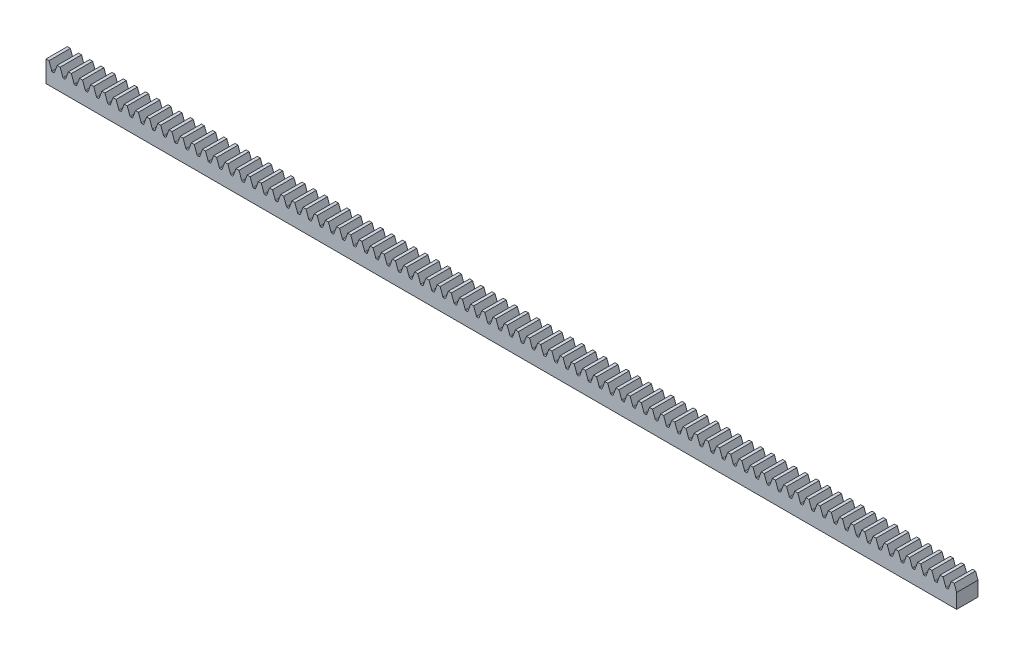
from build123d import *

# Parameters (mm, degrees)
SKETCH1_W           = 203.2
SKETCH1_H           = 4.7752
BOSS_EXTRUDE1_DEPTH = 2.38125
CUT_EXTRUDE1_DEPTH  = 4.7625
FILLET3_R           = 0.154943948
LPATTERN4_START     = -2.38125
LPATTERN4_DEPTH     = 4.7625


# Read off the part's stored shape, not the designer's step: LPattern4
with BuildPart() as part:
    # Sketch1 → Boss-Extrude1 (new, symmetric)
    with BuildSketch(Plane.XY):
        Rectangle(SKETCH1_W, SKETCH1_H)
    extrude(amount=BOSS_EXTRUDE1_DEPTH, both=True)

    # Sketch2 → Cut-Extrude1 (cut)
    with BuildSketch(Plane.XY.offset(2.38125)):
        Polygon((-100.930980247, 2.3876), (-100.276907537, 0.59055), (-99.760427709, 0.59055), (-99.106355, 2.3876), align=None)
    extrude(amount=-CUT_EXTRUDE1_DEPTH, mode=Mode.SUBTRACT)

    # Fillet3
    fillet3_edges = [part.edges().sort_by_distance(p)[0] for p in [
        (-99.760427709, 0.59055, 0),
        (-100.276907537, 0.59055, 0),
    ]]
    fillet(fillet3_edges, radius=FILLET3_R)

    # LPattern4 outline → LPattern4 (cut)
    with BuildSketch(Plane.XY.offset(LPATTERN4_START)):
        with BuildLine():
            ThreePointArc((-97.820369302, 0.692499997), (-97.763641815, 0.618571296), (-97.674769617, 0.59055))
            Line((-97.674769617, 0.59055), (-97.37527563, 0.59055))
            ThreePointArc((-97.37527563, 0.59055), (-97.286403432, 0.618571296), (-97.229675945, 0.692499997))
            Line((-97.229675945, 0.692499997), (-96.61271, 2.3876))
            Line((-96.61271, 2.3876), (-98.437335247, 2.3876))
            Line((-98.437335247, 2.3876), (-97.820369302, 0.692499997))
        make_face()
        Polygon((101.6, 2.3876), (101.054264753, 2.3876), (101.6, 0.888204732), align=None)
        with BuildLine():
            Line((100.385245, 2.3876), (98.560619753, 2.3876))
            Line((98.560619753, 2.3876), (99.177585698, 0.692499997))
            ThreePointArc((99.177585698, 0.692499997), (99.234313185, 0.618571296), (99.323185383, 0.59055))
            Line((99.323185383, 0.59055), (99.62267937, 0.59055))
            ThreePointArc((99.62267937, 0.59055), (99.711551568, 0.618571296), (99.768279055, 0.692499997))
            Line((99.768279055, 0.692499997), (100.385245, 2.3876))
        make_face()
        with BuildLine():
            Line((97.8916, 2.3876), (96.066974753, 2.3876))
            Line((96.066974753, 2.3876), (96.683940698, 0.692499997))
            ThreePointArc((96.683940698, 0.692499997), (96.740668185, 0.618571296), (96.829540383, 0.59055))
            Line((96.829540383, 0.59055), (97.12903437, 0.59055))
            ThreePointArc((97.12903437, 0.59055), (97.217906568, 0.618571296), (97.274634055, 0.692499997))
            Line((97.274634055, 0.692499997), (97.8916, 2.3876))
        make_face()
        with BuildLine():
            Line((95.397955, 2.3876), (93.573329753, 2.3876))
            Line((93.573329753, 2.3876), (94.190295698, 0.692499997))
            ThreePointArc((94.190295698, 0.692499997), (94.247023185, 0.618571296), (94.335895383, 0.59055))
            Line((94.335895383, 0.59055), (94.63538937, 0.59055))
            ThreePointArc((94.63538937, 0.59055), (94.724261568, 0.618571296), (94.780989055, 0.692499997))
            Line((94.780989055, 0.692499997), (95.397955, 2.3876))
        make_face()
        with BuildLine():
            Line((92.90431, 2.3876), (91.079684753, 2.3876))
            Line((91.079684753, 2.3876), (91.696650698, 0.692499997))
            ThreePointArc((91.696650698, 0.692499997), (91.753378185, 0.618571296), (91.842250383, 0.59055))
            Line((91.842250383, 0.59055), (92.14174437, 0.59055))
            ThreePointArc((92.14174437, 0.59055), (92.230616568, 0.618571296), (92.287344055, 0.692499997))
            Line((92.287344055, 0.692499997), (92.90431, 2.3876))
        make_face()
        with BuildLine():
            Line((90.410665, 2.3876), (88.586039753, 2.3876))
            Line((88.586039753, 2.3876), (89.203005698, 0.692499997))
            ThreePointArc((89.203005698, 0.692499997), (89.259733185, 0.618571296), (89.348605383, 0.59055))
            Line((89.348605383, 0.59055), (89.64809937, 0.59055))
            ThreePointArc((89.64809937, 0.59055), (89.736971568, 0.618571296), (89.793699055, 0.692499997))
            Line((89.793699055, 0.692499997), (90.410665, 2.3876))
        make_face()
        with BuildLine():
            Line((87.91702, 2.3876), (86.092394753, 2.3876))
            Line((86.092394753, 2.3876), (86.709360698, 0.692499997))
            ThreePointArc((86.709360698, 0.692499997), (86.766088185, 0.618571296), (86.854960383, 0.59055))
            Line((86.854960383, 0.59055), (87.15445437, 0.59055))
            ThreePointArc((87.15445437, 0.59055), (87.243326568, 0.618571296), (87.300054055, 0.692499997))
            Line((87.300054055, 0.692499997), (87.91702, 2.3876))
        make_face()
        with BuildLine():
            Line((85.423375, 2.3876), (83.598749753, 2.3876))
            Line((83.598749753, 2.3876), (84.215715698, 0.692499997))
            ThreePointArc((84.215715698, 0.692499997), (84.272443185, 0.618571296), (84.361315383, 0.59055))
            Line((84.361315383, 0.59055), (84.66080937, 0.59055))
            ThreePointArc((84.66080937, 0.59055), (84.749681568, 0.618571296), (84.806409055, 0.692499997))
            Line((84.806409055, 0.692499997), (85.423375, 2.3876))
        make_face()
        with BuildLine():
            Line((82.92973, 2.3876), (81.105104753, 2.3876))
            Line((81.105104753, 2.3876), (81.722070698, 0.692499997))
            ThreePointArc((81.722070698, 0.692499997), (81.778798185, 0.618571296), (81.867670383, 0.59055))
            Line((81.867670383, 0.59055), (82.16716437, 0.59055))
            ThreePointArc((82.16716437, 0.59055), (82.256036568, 0.618571296), (82.312764055, 0.692499997))
            Line((82.312764055, 0.692499997), (82.92973, 2.3876))
        make_face()
        with BuildLine():
            Line((80.436085, 2.3876), (78.611459753, 2.3876))
            Line((78.611459753, 2.3876), (79.228425698, 0.692499997))
            ThreePointArc((79.228425698, 0.692499997), (79.285153185, 0.618571296), (79.374025383, 0.59055))
            Line((79.374025383, 0.59055), (79.67351937, 0.59055))
            ThreePointArc((79.67351937, 0.59055), (79.762391568, 0.618571296), (79.819119055, 0.692499997))
            Line((79.819119055, 0.692499997), (80.436085, 2.3876))
        make_face()
        with BuildLine():
            Line((77.94244, 2.3876), (76.117814753, 2.3876))
            Line((76.117814753, 2.3876), (76.734780698, 0.692499997))
            ThreePointArc((76.734780698, 0.692499997), (76.791508185, 0.618571296), (76.880380383, 0.59055))
            Line((76.880380383, 0.59055), (77.17987437, 0.59055))
            ThreePointArc((77.17987437, 0.59055), (77.268746568, 0.618571296), (77.325474055, 0.692499997))
            Line((77.325474055, 0.692499997), (77.94244, 2.3876))
        make_face()
        with BuildLine():
            Line((75.448795, 2.3876), (73.624169753, 2.3876))
            Line((73.624169753, 2.3876), (74.241135698, 0.692499997))
            ThreePointArc((74.241135698, 0.692499997), (74.297863185, 0.618571296), (74.386735383, 0.59055))
            Line((74.386735383, 0.59055), (74.68622937, 0.59055))
            ThreePointArc((74.68622937, 0.59055), (74.775101568, 0.618571296), (74.831829055, 0.692499997))
            Line((74.831829055, 0.692499997), (75.448795, 2.3876))
        make_face()
        with BuildLine():
            Line((72.95515, 2.3876), (71.130524753, 2.3876))
            Line((71.130524753, 2.3876), (71.747490698, 0.692499997))
            ThreePointArc((71.747490698, 0.692499997), (71.804218185, 0.618571296), (71.893090383, 0.59055))
            Line((71.893090383, 0.59055), (72.19258437, 0.59055))
            ThreePointArc((72.19258437, 0.59055), (72.281456568, 0.618571296), (72.338184055, 0.692499997))
            Line((72.338184055, 0.692499997), (72.95515, 2.3876))
        make_face()
        with BuildLine():
            Line((70.461505, 2.3876), (68.636879753, 2.3876))
            Line((68.636879753, 2.3876), (69.253845698, 0.692499997))
            ThreePointArc((69.253845698, 0.692499997), (69.310573185, 0.618571296), (69.399445383, 0.59055))
            Line((69.399445383, 0.59055), (69.69893937, 0.59055))
            ThreePointArc((69.69893937, 0.59055), (69.787811568, 0.618571296), (69.844539055, 0.692499997))
            Line((69.844539055, 0.692499997), (70.461505, 2.3876))
        make_face()
        with BuildLine():
            Line((67.96786, 2.3876), (66.143234753, 2.3876))
            Line((66.143234753, 2.3876), (66.760200698, 0.692499997))
            ThreePointArc((66.760200698, 0.692499997), (66.816928185, 0.618571296), (66.905800383, 0.59055))
            Line((66.905800383, 0.59055), (67.20529437, 0.59055))
            ThreePointArc((67.20529437, 0.59055), (67.294166568, 0.618571296), (67.350894055, 0.692499997))
            Line((67.350894055, 0.692499997), (67.96786, 2.3876))
        make_face()
        with BuildLine():
            Line((65.474215, 2.3876), (63.649589753, 2.3876))
            Line((63.649589753, 2.3876), (64.266555698, 0.692499997))
            ThreePointArc((64.266555698, 0.692499997), (64.323283185, 0.618571296), (64.412155383, 0.59055))
            Line((64.412155383, 0.59055), (64.71164937, 0.59055))
            ThreePointArc((64.71164937, 0.59055), (64.800521568, 0.618571296), (64.857249055, 0.692499997))
            Line((64.857249055, 0.692499997), (65.474215, 2.3876))
        make_face()
        with BuildLine():
            Line((62.98057, 2.3876), (61.155944753, 2.3876))
            Line((61.155944753, 2.3876), (61.772910698, 0.692499997))
            ThreePointArc((61.772910698, 0.692499997), (61.829638185, 0.618571296), (61.918510383, 0.59055))
            Line((61.918510383, 0.59055), (62.21800437, 0.59055))
            ThreePointArc((62.21800437, 0.59055), (62.306876568, 0.618571296), (62.363604055, 0.692499997))
            Line((62.363604055, 0.692499997), (62.98057, 2.3876))
        make_face()
        with BuildLine():
            Line((60.486925, 2.3876), (58.662299753, 2.3876))
            Line((58.662299753, 2.3876), (59.279265698, 0.692499997))
            ThreePointArc((59.279265698, 0.692499997), (59.335993185, 0.618571296), (59.424865383, 0.59055))
            Line((59.424865383, 0.59055), (59.72435937, 0.59055))
            ThreePointArc((59.72435937, 0.59055), (59.813231568, 0.618571296), (59.869959055, 0.692499997))
            Line((59.869959055, 0.692499997), (60.486925, 2.3876))
        make_face()
        with BuildLine():
            Line((57.99328, 2.3876), (56.168654753, 2.3876))
            Line((56.168654753, 2.3876), (56.785620698, 0.692499997))
            ThreePointArc((56.785620698, 0.692499997), (56.842348185, 0.618571296), (56.931220383, 0.59055))
            Line((56.931220383, 0.59055), (57.23071437, 0.59055))
            ThreePointArc((57.23071437, 0.59055), (57.319586568, 0.618571296), (57.376314055, 0.692499997))
            Line((57.376314055, 0.692499997), (57.99328, 2.3876))
        make_face()
        with BuildLine():
            Line((55.499635, 2.3876), (53.675009753, 2.3876))
            Line((53.675009753, 2.3876), (54.291975698, 0.692499997))
            ThreePointArc((54.291975698, 0.692499997), (54.348703185, 0.618571296), (54.437575383, 0.59055))
            Line((54.437575383, 0.59055), (54.73706937, 0.59055))
            ThreePointArc((54.73706937, 0.59055), (54.825941568, 0.618571296), (54.882669055, 0.692499997))
            Line((54.882669055, 0.692499997), (55.499635, 2.3876))
        make_face()
        with BuildLine():
            Line((53.00599, 2.3876), (51.181364753, 2.3876))
            Line((51.181364753, 2.3876), (51.798330698, 0.692499997))
            ThreePointArc((51.798330698, 0.692499997), (51.855058185, 0.618571296), (51.943930383, 0.59055))
            Line((51.943930383, 0.59055), (52.24342437, 0.59055))
            ThreePointArc((52.24342437, 0.59055), (52.332296568, 0.618571296), (52.389024055, 0.692499997))
            Line((52.389024055, 0.692499997), (53.00599, 2.3876))
        make_face()
        with BuildLine():
            Line((50.512345, 2.3876), (48.687719753, 2.3876))
            Line((48.687719753, 2.3876), (49.304685698, 0.692499997))
            ThreePointArc((49.304685698, 0.692499997), (49.361413185, 0.618571296), (49.450285383, 0.59055))
            Line((49.450285383, 0.59055), (49.74977937, 0.59055))
            ThreePointArc((49.74977937, 0.59055), (49.838651568, 0.618571296), (49.895379055, 0.692499997))
            Line((49.895379055, 0.692499997), (50.512345, 2.3876))
        make_face()
        with BuildLine():
            Line((48.0187, 2.3876), (46.194074753, 2.3876))
            Line((46.194074753, 2.3876), (46.811040698, 0.692499997))
            ThreePointArc((46.811040698, 0.692499997), (46.867768185, 0.618571296), (46.956640383, 0.59055))
            Line((46.956640383, 0.59055), (47.25613437, 0.59055))
            ThreePointArc((47.25613437, 0.59055), (47.345006568, 0.618571296), (47.401734055, 0.692499997))
            Line((47.401734055, 0.692499997), (48.0187, 2.3876))
        make_face()
        with BuildLine():
            Line((45.525055, 2.3876), (43.700429753, 2.3876))
            Line((43.700429753, 2.3876), (44.317395698, 0.692499997))
            ThreePointArc((44.317395698, 0.692499997), (44.374123185, 0.618571296), (44.462995383, 0.59055))
            Line((44.462995383, 0.59055), (44.76248937, 0.59055))
            ThreePointArc((44.76248937, 0.59055), (44.851361568, 0.618571296), (44.908089055, 0.692499997))
            Line((44.908089055, 0.692499997), (45.525055, 2.3876))
        make_face()
        with BuildLine():
            Line((43.03141, 2.3876), (41.206784753, 2.3876))
            Line((41.206784753, 2.3876), (41.823750698, 0.692499997))
            ThreePointArc((41.823750698, 0.692499997), (41.880478185, 0.618571296), (41.969350383, 0.59055))
            Line((41.969350383, 0.59055), (42.26884437, 0.59055))
            ThreePointArc((42.26884437, 0.59055), (42.357716568, 0.618571296), (42.414444055, 0.692499997))
            Line((42.414444055, 0.692499997), (43.03141, 2.3876))
        make_face()
        with BuildLine():
            Line((40.537765, 2.3876), (38.713139753, 2.3876))
            Line((38.713139753, 2.3876), (39.330105698, 0.692499997))
            ThreePointArc((39.330105698, 0.692499997), (39.386833185, 0.618571296), (39.475705383, 0.59055))
            Line((39.475705383, 0.59055), (39.77519937, 0.59055))
            ThreePointArc((39.77519937, 0.59055), (39.864071568, 0.618571296), (39.920799055, 0.692499997))
            Line((39.920799055, 0.692499997), (40.537765, 2.3876))
        make_face()
        with BuildLine():
            Line((38.04412, 2.3876), (36.219494753, 2.3876))
            Line((36.219494753, 2.3876), (36.836460698, 0.692499997))
            ThreePointArc((36.836460698, 0.692499997), (36.893188185, 0.618571296), (36.982060383, 0.59055))
            Line((36.982060383, 0.59055), (37.28155437, 0.59055))
            ThreePointArc((37.28155437, 0.59055), (37.370426568, 0.618571296), (37.427154055, 0.692499997))
            Line((37.427154055, 0.692499997), (38.04412, 2.3876))
        make_face()
        with BuildLine():
            Line((35.550475, 2.3876), (33.725849753, 2.3876))
            Line((33.725849753, 2.3876), (34.342815698, 0.692499997))
            ThreePointArc((34.342815698, 0.692499997), (34.399543185, 0.618571296), (34.488415383, 0.59055))
            Line((34.488415383, 0.59055), (34.78790937, 0.59055))
            ThreePointArc((34.78790937, 0.59055), (34.876781568, 0.618571296), (34.933509055, 0.692499997))
            Line((34.933509055, 0.692499997), (35.550475, 2.3876))
        make_face()
        with BuildLine():
            Line((33.05683, 2.3876), (31.232204753, 2.3876))
            Line((31.232204753, 2.3876), (31.849170698, 0.692499997))
            ThreePointArc((31.849170698, 0.692499997), (31.905898185, 0.618571296), (31.994770383, 0.59055))
            Line((31.994770383, 0.59055), (32.29426437, 0.59055))
            ThreePointArc((32.29426437, 0.59055), (32.383136568, 0.618571296), (32.439864055, 0.692499997))
            Line((32.439864055, 0.692499997), (33.05683, 2.3876))
        make_face()
        with BuildLine():
            Line((30.563185, 2.3876), (28.738559753, 2.3876))
            Line((28.738559753, 2.3876), (29.355525698, 0.692499997))
            ThreePointArc((29.355525698, 0.692499997), (29.412253185, 0.618571296), (29.501125383, 0.59055))
            Line((29.501125383, 0.59055), (29.80061937, 0.59055))
            ThreePointArc((29.80061937, 0.59055), (29.889491568, 0.618571296), (29.946219055, 0.692499997))
            Line((29.946219055, 0.692499997), (30.563185, 2.3876))
        make_face()
        with BuildLine():
            Line((28.06954, 2.3876), (26.244914753, 2.3876))
            Line((26.244914753, 2.3876), (26.861880698, 0.692499997))
            ThreePointArc((26.861880698, 0.692499997), (26.918608185, 0.618571296), (27.007480383, 0.59055))
            Line((27.007480383, 0.59055), (27.30697437, 0.59055))
            ThreePointArc((27.30697437, 0.59055), (27.395846568, 0.618571296), (27.452574055, 0.692499997))
            Line((27.452574055, 0.692499997), (28.06954, 2.3876))
        make_face()
        with BuildLine():
            Line((25.575895, 2.3876), (23.751269753, 2.3876))
            Line((23.751269753, 2.3876), (24.368235698, 0.692499997))
            ThreePointArc((24.368235698, 0.692499997), (24.424963185, 0.618571296), (24.513835383, 0.59055))
            Line((24.513835383, 0.59055), (24.81332937, 0.59055))
            ThreePointArc((24.81332937, 0.59055), (24.902201568, 0.618571296), (24.958929055, 0.692499997))
            Line((24.958929055, 0.692499997), (25.575895, 2.3876))
        make_face()
        with BuildLine():
            Line((23.08225, 2.3876), (21.257624753, 2.3876))
            Line((21.257624753, 2.3876), (21.874590698, 0.692499997))
            ThreePointArc((21.874590698, 0.692499997), (21.931318185, 0.618571296), (22.020190383, 0.59055))
            Line((22.020190383, 0.59055), (22.31968437, 0.59055))
            ThreePointArc((22.31968437, 0.59055), (22.408556568, 0.618571296), (22.465284055, 0.692499997))
            Line((22.465284055, 0.692499997), (23.08225, 2.3876))
        make_face()
        with BuildLine():
            Line((20.588605, 2.3876), (18.763979753, 2.3876))
            Line((18.763979753, 2.3876), (19.380945698, 0.692499997))
            ThreePointArc((19.380945698, 0.692499997), (19.437673185, 0.618571296), (19.526545383, 0.59055))
            Line((19.526545383, 0.59055), (19.82603937, 0.59055))
            ThreePointArc((19.82603937, 0.59055), (19.914911568, 0.618571296), (19.971639055, 0.692499997))
            Line((19.971639055, 0.692499997), (20.588605, 2.3876))
        make_face()
        with BuildLine():
            Line((18.09496, 2.3876), (16.270334753, 2.3876))
            Line((16.270334753, 2.3876), (16.887300698, 0.692499997))
            ThreePointArc((16.887300698, 0.692499997), (16.944028185, 0.618571296), (17.032900383, 0.59055))
            Line((17.032900383, 0.59055), (17.33239437, 0.59055))
            ThreePointArc((17.33239437, 0.59055), (17.421266568, 0.618571296), (17.477994055, 0.692499997))
            Line((17.477994055, 0.692499997), (18.09496, 2.3876))
        make_face()
        with BuildLine():
            Line((15.601315, 2.3876), (13.776689753, 2.3876))
            Line((13.776689753, 2.3876), (14.393655698, 0.692499997))
            ThreePointArc((14.393655698, 0.692499997), (14.450383185, 0.618571296), (14.539255383, 0.59055))
            Line((14.539255383, 0.59055), (14.83874937, 0.59055))
            ThreePointArc((14.83874937, 0.59055), (14.927621568, 0.618571296), (14.984349055, 0.692499997))
            Line((14.984349055, 0.692499997), (15.601315, 2.3876))
        make_face()
        with BuildLine():
            Line((13.10767, 2.3876), (11.283044753, 2.3876))
            Line((11.283044753, 2.3876), (11.900010698, 0.692499997))
            ThreePointArc((11.900010698, 0.692499997), (11.956738185, 0.618571296), (12.045610383, 0.59055))
            Line((12.045610383, 0.59055), (12.34510437, 0.59055))
            ThreePointArc((12.34510437, 0.59055), (12.433976568, 0.618571296), (12.490704055, 0.692499997))
            Line((12.490704055, 0.692499997), (13.10767, 2.3876))
        make_face()
        with BuildLine():
            Line((10.614025, 2.3876), (8.789399753, 2.3876))
            Line((8.789399753, 2.3876), (9.406365698, 0.692499997))
            ThreePointArc((9.406365698, 0.692499997), (9.463093185, 0.618571296), (9.551965383, 0.59055))
            Line((9.551965383, 0.59055), (9.85145937, 0.59055))
            ThreePointArc((9.85145937, 0.59055), (9.940331568, 0.618571296), (9.997059055, 0.692499997))
            Line((9.997059055, 0.692499997), (10.614025, 2.3876))
        make_face()
        with BuildLine():
            Line((8.12038, 2.3876), (6.295754753, 2.3876))
            Line((6.295754753, 2.3876), (6.912720698, 0.692499997))
            ThreePointArc((6.912720698, 0.692499997), (6.969448185, 0.618571296), (7.058320383, 0.59055))
            Line((7.058320383, 0.59055), (7.35781437, 0.59055))
            ThreePointArc((7.35781437, 0.59055), (7.446686568, 0.618571296), (7.503414055, 0.692499997))
            Line((7.503414055, 0.692499997), (8.12038, 2.3876))
        make_face()
        with BuildLine():
            Line((5.626735, 2.3876), (3.802109753, 2.3876))
            Line((3.802109753, 2.3876), (4.419075698, 0.692499997))
            ThreePointArc((4.419075698, 0.692499997), (4.475803185, 0.618571296), (4.564675383, 0.59055))
            Line((4.564675383, 0.59055), (4.86416937, 0.59055))
            ThreePointArc((4.86416937, 0.59055), (4.953041568, 0.618571296), (5.009769055, 0.692499997))
            Line((5.009769055, 0.692499997), (5.626735, 2.3876))
        make_face()
        with BuildLine():
            Line((3.13309, 2.3876), (1.308464753, 2.3876))
            Line((1.308464753, 2.3876), (1.925430698, 0.692499997))
            ThreePointArc((1.925430698, 0.692499997), (1.982158185, 0.618571296), (2.071030383, 0.59055))
            Line((2.071030383, 0.59055), (2.37052437, 0.59055))
            ThreePointArc((2.37052437, 0.59055), (2.459396568, 0.618571296), (2.516124055, 0.692499997))
            Line((2.516124055, 0.692499997), (3.13309, 2.3876))
        make_face()
        with BuildLine():
            Line((0.639445, 2.3876), (-1.185180247, 2.3876))
            Line((-1.185180247, 2.3876), (-0.568214302, 0.692499997))
            ThreePointArc((-0.568214302, 0.692499997), (-0.511486815, 0.618571296), (-0.422614617, 0.59055))
            Line((-0.422614617, 0.59055), (-0.12312063, 0.59055))
            ThreePointArc((-0.12312063, 0.59055), (-0.034248432, 0.618571296), (0.022479055, 0.692499997))
            Line((0.022479055, 0.692499997), (0.639445, 2.3876))
        make_face()
        with BuildLine():
            Line((-1.8542, 2.3876), (-3.678825247, 2.3876))
            Line((-3.678825247, 2.3876), (-3.061859302, 0.692499997))
            ThreePointArc((-3.061859302, 0.692499997), (-3.005131815, 0.618571296), (-2.916259617, 0.59055))
            Line((-2.916259617, 0.59055), (-2.61676563, 0.59055))
            ThreePointArc((-2.61676563, 0.59055), (-2.527893432, 0.618571296), (-2.471165945, 0.692499997))
            Line((-2.471165945, 0.692499997), (-1.8542, 2.3876))
        make_face()
        with BuildLine():
            Line((-4.347845, 2.3876), (-6.172470247, 2.3876))
            Line((-6.172470247, 2.3876), (-5.555504302, 0.692499997))
            ThreePointArc((-5.555504302, 0.692499997), (-5.498776815, 0.618571296), (-5.409904617, 0.59055))
            Line((-5.409904617, 0.59055), (-5.11041063, 0.59055))
            ThreePointArc((-5.11041063, 0.59055), (-5.021538432, 0.618571296), (-4.964810945, 0.692499997))
            Line((-4.964810945, 0.692499997), (-4.347845, 2.3876))
        make_face()
        with BuildLine():
            Line((-6.84149, 2.3876), (-8.666115247, 2.3876))
            Line((-8.666115247, 2.3876), (-8.049149302, 0.692499997))
            ThreePointArc((-8.049149302, 0.692499997), (-7.992421815, 0.618571296), (-7.903549617, 0.59055))
            Line((-7.903549617, 0.59055), (-7.60405563, 0.59055))
            ThreePointArc((-7.60405563, 0.59055), (-7.515183432, 0.618571296), (-7.458455945, 0.692499997))
            Line((-7.458455945, 0.692499997), (-6.84149, 2.3876))
        make_face()
        with BuildLine():
            Line((-9.335135, 2.3876), (-11.159760247, 2.3876))
            Line((-11.159760247, 2.3876), (-10.542794302, 0.692499997))
            ThreePointArc((-10.542794302, 0.692499997), (-10.486066815, 0.618571296), (-10.397194617, 0.59055))
            Line((-10.397194617, 0.59055), (-10.09770063, 0.59055))
            ThreePointArc((-10.09770063, 0.59055), (-10.008828432, 0.618571296), (-9.952100945, 0.692499997))
            Line((-9.952100945, 0.692499997), (-9.335135, 2.3876))
        make_face()
        with BuildLine():
            Line((-11.82878, 2.3876), (-13.653405247, 2.3876))
            Line((-13.653405247, 2.3876), (-13.036439302, 0.692499997))
            ThreePointArc((-13.036439302, 0.692499997), (-12.979711815, 0.618571296), (-12.890839617, 0.59055))
            Line((-12.890839617, 0.59055), (-12.59134563, 0.59055))
            ThreePointArc((-12.59134563, 0.59055), (-12.502473432, 0.618571296), (-12.445745945, 0.692499997))
            Line((-12.445745945, 0.692499997), (-11.82878, 2.3876))
        make_face()
        with BuildLine():
            Line((-14.322425, 2.3876), (-16.147050247, 2.3876))
            Line((-16.147050247, 2.3876), (-15.530084302, 0.692499997))
            ThreePointArc((-15.530084302, 0.692499997), (-15.473356815, 0.618571296), (-15.384484617, 0.59055))
            Line((-15.384484617, 0.59055), (-15.08499063, 0.59055))
            ThreePointArc((-15.08499063, 0.59055), (-14.996118432, 0.618571296), (-14.939390945, 0.692499997))
            Line((-14.939390945, 0.692499997), (-14.322425, 2.3876))
        make_face()
        with BuildLine():
            Line((-16.81607, 2.3876), (-18.640695247, 2.3876))
            Line((-18.640695247, 2.3876), (-18.023729302, 0.692499997))
            ThreePointArc((-18.023729302, 0.692499997), (-17.967001815, 0.618571296), (-17.878129617, 0.59055))
            Line((-17.878129617, 0.59055), (-17.57863563, 0.59055))
            ThreePointArc((-17.57863563, 0.59055), (-17.489763432, 0.618571296), (-17.433035945, 0.692499997))
            Line((-17.433035945, 0.692499997), (-16.81607, 2.3876))
        make_face()
        with BuildLine():
            Line((-19.309715, 2.3876), (-21.134340247, 2.3876))
            Line((-21.134340247, 2.3876), (-20.517374302, 0.692499997))
            ThreePointArc((-20.517374302, 0.692499997), (-20.460646815, 0.618571296), (-20.371774617, 0.59055))
            Line((-20.371774617, 0.59055), (-20.07228063, 0.59055))
            ThreePointArc((-20.07228063, 0.59055), (-19.983408432, 0.618571296), (-19.926680945, 0.692499997))
            Line((-19.926680945, 0.692499997), (-19.309715, 2.3876))
        make_face()
        with BuildLine():
            Line((-21.80336, 2.3876), (-23.627985247, 2.3876))
            Line((-23.627985247, 2.3876), (-23.011019302, 0.692499997))
            ThreePointArc((-23.011019302, 0.692499997), (-22.954291815, 0.618571296), (-22.865419617, 0.59055))
            Line((-22.865419617, 0.59055), (-22.56592563, 0.59055))
            ThreePointArc((-22.56592563, 0.59055), (-22.477053432, 0.618571296), (-22.420325945, 0.692499997))
            Line((-22.420325945, 0.692499997), (-21.80336, 2.3876))
        make_face()
        with BuildLine():
            Line((-24.297005, 2.3876), (-26.121630247, 2.3876))
            Line((-26.121630247, 2.3876), (-25.504664302, 0.692499997))
            ThreePointArc((-25.504664302, 0.692499997), (-25.447936815, 0.618571296), (-25.359064617, 0.59055))
            Line((-25.359064617, 0.59055), (-25.05957063, 0.59055))
            ThreePointArc((-25.05957063, 0.59055), (-24.970698432, 0.618571296), (-24.913970945, 0.692499997))
            Line((-24.913970945, 0.692499997), (-24.297005, 2.3876))
        make_face()
        with BuildLine():
            Line((-26.79065, 2.3876), (-28.615275247, 2.3876))
            Line((-28.615275247, 2.3876), (-27.998309302, 0.692499997))
            ThreePointArc((-27.998309302, 0.692499997), (-27.941581815, 0.618571296), (-27.852709617, 0.59055))
            Line((-27.852709617, 0.59055), (-27.55321563, 0.59055))
            ThreePointArc((-27.55321563, 0.59055), (-27.464343432, 0.618571296), (-27.407615945, 0.692499997))
            Line((-27.407615945, 0.692499997), (-26.79065, 2.3876))
        make_face()
        with BuildLine():
            Line((-29.284295, 2.3876), (-31.108920247, 2.3876))
            Line((-31.108920247, 2.3876), (-30.491954302, 0.692499997))
            ThreePointArc((-30.491954302, 0.692499997), (-30.435226815, 0.618571296), (-30.346354617, 0.59055))
            Line((-30.346354617, 0.59055), (-30.04686063, 0.59055))
            ThreePointArc((-30.04686063, 0.59055), (-29.957988432, 0.618571296), (-29.901260945, 0.692499997))
            Line((-29.901260945, 0.692499997), (-29.284295, 2.3876))
        make_face()
        with BuildLine():
            Line((-31.77794, 2.3876), (-33.602565247, 2.3876))
            Line((-33.602565247, 2.3876), (-32.985599302, 0.692499997))
            ThreePointArc((-32.985599302, 0.692499997), (-32.928871815, 0.618571296), (-32.839999617, 0.59055))
            Line((-32.839999617, 0.59055), (-32.54050563, 0.59055))
            ThreePointArc((-32.54050563, 0.59055), (-32.451633432, 0.618571296), (-32.394905945, 0.692499997))
            Line((-32.394905945, 0.692499997), (-31.77794, 2.3876))
        make_face()
        with BuildLine():
            Line((-34.271585, 2.3876), (-36.096210247, 2.3876))
            Line((-36.096210247, 2.3876), (-35.479244302, 0.692499997))
            ThreePointArc((-35.479244302, 0.692499997), (-35.422516815, 0.618571296), (-35.333644617, 0.59055))
            Line((-35.333644617, 0.59055), (-35.03415063, 0.59055))
            ThreePointArc((-35.03415063, 0.59055), (-34.945278432, 0.618571296), (-34.888550945, 0.692499997))
            Line((-34.888550945, 0.692499997), (-34.271585, 2.3876))
        make_face()
        with BuildLine():
            Line((-36.76523, 2.3876), (-38.589855247, 2.3876))
            Line((-38.589855247, 2.3876), (-37.972889302, 0.692499997))
            ThreePointArc((-37.972889302, 0.692499997), (-37.916161815, 0.618571296), (-37.827289617, 0.59055))
            Line((-37.827289617, 0.59055), (-37.52779563, 0.59055))
            ThreePointArc((-37.52779563, 0.59055), (-37.438923432, 0.618571296), (-37.382195945, 0.692499997))
            Line((-37.382195945, 0.692499997), (-36.76523, 2.3876))
        make_face()
        with BuildLine():
            Line((-39.258875, 2.3876), (-41.083500247, 2.3876))
            Line((-41.083500247, 2.3876), (-40.466534302, 0.692499997))
            ThreePointArc((-40.466534302, 0.692499997), (-40.409806815, 0.618571296), (-40.320934617, 0.59055))
            Line((-40.320934617, 0.59055), (-40.02144063, 0.59055))
            ThreePointArc((-40.02144063, 0.59055), (-39.932568432, 0.618571296), (-39.875840945, 0.692499997))
            Line((-39.875840945, 0.692499997), (-39.258875, 2.3876))
        make_face()
        with BuildLine():
            Line((-41.75252, 2.3876), (-43.577145247, 2.3876))
            Line((-43.577145247, 2.3876), (-42.960179302, 0.692499997))
            ThreePointArc((-42.960179302, 0.692499997), (-42.903451815, 0.618571296), (-42.814579617, 0.59055))
            Line((-42.814579617, 0.59055), (-42.51508563, 0.59055))
            ThreePointArc((-42.51508563, 0.59055), (-42.426213432, 0.618571296), (-42.369485945, 0.692499997))
            Line((-42.369485945, 0.692499997), (-41.75252, 2.3876))
        make_face()
        with BuildLine():
            Line((-44.246165, 2.3876), (-46.070790247, 2.3876))
            Line((-46.070790247, 2.3876), (-45.453824302, 0.692499997))
            ThreePointArc((-45.453824302, 0.692499997), (-45.397096815, 0.618571296), (-45.308224617, 0.59055))
            Line((-45.308224617, 0.59055), (-45.00873063, 0.59055))
            ThreePointArc((-45.00873063, 0.59055), (-44.919858432, 0.618571296), (-44.863130945, 0.692499997))
            Line((-44.863130945, 0.692499997), (-44.246165, 2.3876))
        make_face()
        with BuildLine():
            Line((-46.73981, 2.3876), (-48.564435247, 2.3876))
            Line((-48.564435247, 2.3876), (-47.947469302, 0.692499997))
            ThreePointArc((-47.947469302, 0.692499997), (-47.890741815, 0.618571296), (-47.801869617, 0.59055))
            Line((-47.801869617, 0.59055), (-47.50237563, 0.59055))
            ThreePointArc((-47.50237563, 0.59055), (-47.413503432, 0.618571296), (-47.356775945, 0.692499997))
            Line((-47.356775945, 0.692499997), (-46.73981, 2.3876))
        make_face()
        with BuildLine():
            Line((-49.233455, 2.3876), (-51.058080247, 2.3876))
            Line((-51.058080247, 2.3876), (-50.441114302, 0.692499997))
            ThreePointArc((-50.441114302, 0.692499997), (-50.384386815, 0.618571296), (-50.295514617, 0.59055))
            Line((-50.295514617, 0.59055), (-49.99602063, 0.59055))
            ThreePointArc((-49.99602063, 0.59055), (-49.907148432, 0.618571296), (-49.850420945, 0.692499997))
            Line((-49.850420945, 0.692499997), (-49.233455, 2.3876))
        make_face()
        with BuildLine():
            Line((-51.7271, 2.3876), (-53.551725247, 2.3876))
            Line((-53.551725247, 2.3876), (-52.934759302, 0.692499997))
            ThreePointArc((-52.934759302, 0.692499997), (-52.878031815, 0.618571296), (-52.789159617, 0.59055))
            Line((-52.789159617, 0.59055), (-52.48966563, 0.59055))
            ThreePointArc((-52.48966563, 0.59055), (-52.400793432, 0.618571296), (-52.344065945, 0.692499997))
            Line((-52.344065945, 0.692499997), (-51.7271, 2.3876))
        make_face()
        with BuildLine():
            Line((-54.220745, 2.3876), (-56.045370247, 2.3876))
            Line((-56.045370247, 2.3876), (-55.428404302, 0.692499997))
            ThreePointArc((-55.428404302, 0.692499997), (-55.371676815, 0.618571296), (-55.282804617, 0.59055))
            Line((-55.282804617, 0.59055), (-54.98331063, 0.59055))
            ThreePointArc((-54.98331063, 0.59055), (-54.894438432, 0.618571296), (-54.837710945, 0.692499997))
            Line((-54.837710945, 0.692499997), (-54.220745, 2.3876))
        make_face()
        with BuildLine():
            Line((-56.71439, 2.3876), (-58.539015247, 2.3876))
            Line((-58.539015247, 2.3876), (-57.922049302, 0.692499997))
            ThreePointArc((-57.922049302, 0.692499997), (-57.865321815, 0.618571296), (-57.776449617, 0.59055))
            Line((-57.776449617, 0.59055), (-57.47695563, 0.59055))
            ThreePointArc((-57.47695563, 0.59055), (-57.388083432, 0.618571296), (-57.331355945, 0.692499997))
            Line((-57.331355945, 0.692499997), (-56.71439, 2.3876))
        make_face()
        with BuildLine():
            Line((-59.208035, 2.3876), (-61.032660247, 2.3876))
            Line((-61.032660247, 2.3876), (-60.415694302, 0.692499997))
            ThreePointArc((-60.415694302, 0.692499997), (-60.358966815, 0.618571296), (-60.270094617, 0.59055))
            Line((-60.270094617, 0.59055), (-59.97060063, 0.59055))
            ThreePointArc((-59.97060063, 0.59055), (-59.881728432, 0.618571296), (-59.825000945, 0.692499997))
            Line((-59.825000945, 0.692499997), (-59.208035, 2.3876))
        make_face()
        with BuildLine():
            Line((-61.70168, 2.3876), (-63.526305247, 2.3876))
            Line((-63.526305247, 2.3876), (-62.909339302, 0.692499997))
            ThreePointArc((-62.909339302, 0.692499997), (-62.852611815, 0.618571296), (-62.763739617, 0.59055))
            Line((-62.763739617, 0.59055), (-62.46424563, 0.59055))
            ThreePointArc((-62.46424563, 0.59055), (-62.375373432, 0.618571296), (-62.318645945, 0.692499997))
            Line((-62.318645945, 0.692499997), (-61.70168, 2.3876))
        make_face()
        with BuildLine():
            Line((-64.195325, 2.3876), (-66.019950247, 2.3876))
            Line((-66.019950247, 2.3876), (-65.402984302, 0.692499997))
            ThreePointArc((-65.402984302, 0.692499997), (-65.346256815, 0.618571296), (-65.257384617, 0.59055))
            Line((-65.257384617, 0.59055), (-64.95789063, 0.59055))
            ThreePointArc((-64.95789063, 0.59055), (-64.869018432, 0.618571296), (-64.812290945, 0.692499997))
            Line((-64.812290945, 0.692499997), (-64.195325, 2.3876))
        make_face()
        with BuildLine():
            Line((-66.68897, 2.3876), (-68.513595247, 2.3876))
            Line((-68.513595247, 2.3876), (-67.896629302, 0.692499997))
            ThreePointArc((-67.896629302, 0.692499997), (-67.839901815, 0.618571296), (-67.751029617, 0.59055))
            Line((-67.751029617, 0.59055), (-67.45153563, 0.59055))
            ThreePointArc((-67.45153563, 0.59055), (-67.362663432, 0.618571296), (-67.305935945, 0.692499997))
            Line((-67.305935945, 0.692499997), (-66.68897, 2.3876))
        make_face()
        with BuildLine():
            Line((-69.182615, 2.3876), (-71.007240247, 2.3876))
            Line((-71.007240247, 2.3876), (-70.390274302, 0.692499997))
            ThreePointArc((-70.390274302, 0.692499997), (-70.333546815, 0.618571296), (-70.244674617, 0.59055))
            Line((-70.244674617, 0.59055), (-69.94518063, 0.59055))
            ThreePointArc((-69.94518063, 0.59055), (-69.856308432, 0.618571296), (-69.799580945, 0.692499997))
            Line((-69.799580945, 0.692499997), (-69.182615, 2.3876))
        make_face()
        with BuildLine():
            Line((-71.67626, 2.3876), (-73.500885247, 2.3876))
            Line((-73.500885247, 2.3876), (-72.883919302, 0.692499997))
            ThreePointArc((-72.883919302, 0.692499997), (-72.827191815, 0.618571296), (-72.738319617, 0.59055))
            Line((-72.738319617, 0.59055), (-72.43882563, 0.59055))
            ThreePointArc((-72.43882563, 0.59055), (-72.349953432, 0.618571296), (-72.293225945, 0.692499997))
            Line((-72.293225945, 0.692499997), (-71.67626, 2.3876))
        make_face()
        with BuildLine():
            Line((-74.169905, 2.3876), (-75.994530247, 2.3876))
            Line((-75.994530247, 2.3876), (-75.377564302, 0.692499997))
            ThreePointArc((-75.377564302, 0.692499997), (-75.320836815, 0.618571296), (-75.231964617, 0.59055))
            Line((-75.231964617, 0.59055), (-74.93247063, 0.59055))
            ThreePointArc((-74.93247063, 0.59055), (-74.843598432, 0.618571296), (-74.786870945, 0.692499997))
            Line((-74.786870945, 0.692499997), (-74.169905, 2.3876))
        make_face()
        with BuildLine():
            Line((-76.66355, 2.3876), (-78.488175247, 2.3876))
            Line((-78.488175247, 2.3876), (-77.871209302, 0.692499997))
            ThreePointArc((-77.871209302, 0.692499997), (-77.814481815, 0.618571296), (-77.725609617, 0.59055))
            Line((-77.725609617, 0.59055), (-77.42611563, 0.59055))
            ThreePointArc((-77.42611563, 0.59055), (-77.337243432, 0.618571296), (-77.280515945, 0.692499997))
            Line((-77.280515945, 0.692499997), (-76.66355, 2.3876))
        make_face()
        with BuildLine():
            Line((-79.157195, 2.3876), (-80.981820247, 2.3876))
            Line((-80.981820247, 2.3876), (-80.364854302, 0.692499997))
            ThreePointArc((-80.364854302, 0.692499997), (-80.308126815, 0.618571296), (-80.219254617, 0.59055))
            Line((-80.219254617, 0.59055), (-79.91976063, 0.59055))
            ThreePointArc((-79.91976063, 0.59055), (-79.830888432, 0.618571296), (-79.774160945, 0.692499997))
            Line((-79.774160945, 0.692499997), (-79.157195, 2.3876))
        make_face()
        with BuildLine():
            Line((-81.65084, 2.3876), (-83.475465247, 2.3876))
            Line((-83.475465247, 2.3876), (-82.858499302, 0.692499997))
            ThreePointArc((-82.858499302, 0.692499997), (-82.801771815, 0.618571296), (-82.712899617, 0.59055))
            Line((-82.712899617, 0.59055), (-82.41340563, 0.59055))
            ThreePointArc((-82.41340563, 0.59055), (-82.324533432, 0.618571296), (-82.267805945, 0.692499997))
            Line((-82.267805945, 0.692499997), (-81.65084, 2.3876))
        make_face()
        with BuildLine():
            Line((-84.144485, 2.3876), (-85.969110247, 2.3876))
            Line((-85.969110247, 2.3876), (-85.352144302, 0.692499997))
            ThreePointArc((-85.352144302, 0.692499997), (-85.295416815, 0.618571296), (-85.206544617, 0.59055))
            Line((-85.206544617, 0.59055), (-84.90705063, 0.59055))
            ThreePointArc((-84.90705063, 0.59055), (-84.818178432, 0.618571296), (-84.761450945, 0.692499997))
            Line((-84.761450945, 0.692499997), (-84.144485, 2.3876))
        make_face()
        with BuildLine():
            Line((-86.63813, 2.3876), (-88.462755247, 2.3876))
            Line((-88.462755247, 2.3876), (-87.845789302, 0.692499997))
            ThreePointArc((-87.845789302, 0.692499997), (-87.789061815, 0.618571296), (-87.700189617, 0.59055))
            Line((-87.700189617, 0.59055), (-87.40069563, 0.59055))
            ThreePointArc((-87.40069563, 0.59055), (-87.311823432, 0.618571296), (-87.255095945, 0.692499997))
            Line((-87.255095945, 0.692499997), (-86.63813, 2.3876))
        make_face()
        with BuildLine():
            Line((-89.131775, 2.3876), (-90.956400247, 2.3876))
            Line((-90.956400247, 2.3876), (-90.339434302, 0.692499997))
            ThreePointArc((-90.339434302, 0.692499997), (-90.282706815, 0.618571296), (-90.193834617, 0.59055))
            Line((-90.193834617, 0.59055), (-89.89434063, 0.59055))
            ThreePointArc((-89.89434063, 0.59055), (-89.805468432, 0.618571296), (-89.748740945, 0.692499997))
            Line((-89.748740945, 0.692499997), (-89.131775, 2.3876))
        make_face()
        with BuildLine():
            Line((-91.62542, 2.3876), (-93.450045247, 2.3876))
            Line((-93.450045247, 2.3876), (-92.833079302, 0.692499997))
            ThreePointArc((-92.833079302, 0.692499997), (-92.776351815, 0.618571296), (-92.687479617, 0.59055))
            Line((-92.687479617, 0.59055), (-92.38798563, 0.59055))
            ThreePointArc((-92.38798563, 0.59055), (-92.299113432, 0.618571296), (-92.242385945, 0.692499997))
            Line((-92.242385945, 0.692499997), (-91.62542, 2.3876))
        make_face()
        with BuildLine():
            Line((-94.119065, 2.3876), (-95.943690247, 2.3876))
            Line((-95.943690247, 2.3876), (-95.326724302, 0.692499997))
            ThreePointArc((-95.326724302, 0.692499997), (-95.269996815, 0.618571296), (-95.181124617, 0.59055))
            Line((-95.181124617, 0.59055), (-94.88163063, 0.59055))
            ThreePointArc((-94.88163063, 0.59055), (-94.792758432, 0.618571296), (-94.736030945, 0.692499997))
            Line((-94.736030945, 0.692499997), (-94.119065, 2.3876))
        make_face()
    extrude(amount=LPATTERN4_DEPTH, mode=Mode.SUBTRACT)


solid = part.part
